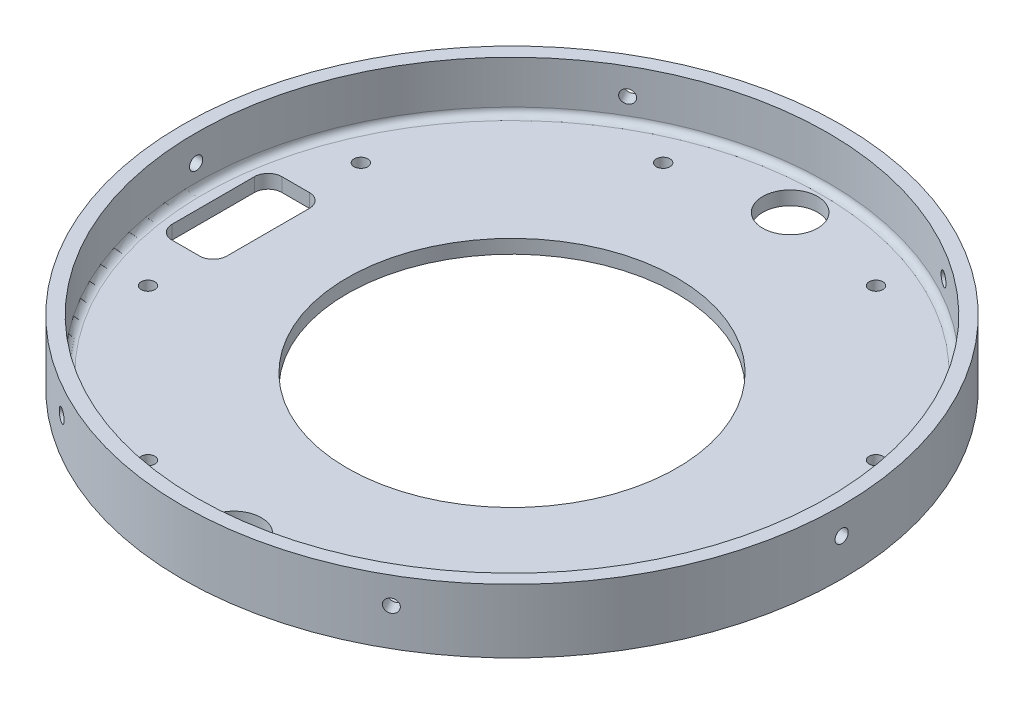
from build123d import *

# Parameters (mm, degrees)
SKETCH1_R           = 76.2
BOSS_EXTRUDE1_DEPTH = 16.256
SHELL1_T            = -3.175
FILLET1_R           = 1.5875
SKETCH2_R           = 38.1
CUT_EXTRUDE1_DEPTH  = 16.256
SKETCH3_R           = 1.524
CUT_EXTRUDE2_DEPTH  = 76.2
CIRPATTERN1_COUNT   = 6
CUT_EXTRUDE4_START  = -1.524
SKETCH5_R           = 76.2
CUT_EXTRUDE4_DEPTH  = 1.524
SKETCH6_R           = 6.35
CUT_EXTRUDE5_DEPTH  = 12.7
SKETCH7_R           = 1.5875
CUT_EXTRUDE6_DEPTH  = 6.35
SKETCH8_W           = 12.7
SKETCH8_H           = 25.4
CUT_EXTRUDE7_DEPTH  = 6.35
FILLET2_R           = 3.175


with BuildPart() as part:
    # Sketch1 → Boss-Extrude1 (new body)
    with BuildSketch(Plane(origin=(0, 0, 0), x_dir=(1, 0, 0), z_dir=(0, 1, 0))):
        Circle(SKETCH1_R)
    extrude(amount=BOSS_EXTRUDE1_DEPTH)

    # Shell1
    shell1_openings = [part.faces().sort_by_distance(p)[0] for p in [
        (0, 16.256, 0),
    ]]
    offset(amount=SHELL1_T, openings=shell1_openings, kind=Kind.INTERSECTION)

    # Fillet1
    fillet1_edges = [part.edges().sort_by_distance(p)[0] for p in [
        (-73.025, 3.175, 0),
    ]]
    fillet(fillet1_edges, radius=FILLET1_R)

    # Sketch2 → Cut-Extrude1 (cut)
    with BuildSketch(Plane.XZ):
        Circle(SKETCH2_R)
    extrude(amount=-CUT_EXTRUDE1_DEPTH, mode=Mode.SUBTRACT)

    # Sketch3 → Cut-Extrude2 (cut)
    with BuildSketch(Plane(origin=(0, 0, 0), x_dir=(0, 0, -1), z_dir=(1, 0, 0))):
        with Locations((0, 8.636)):
            Circle(SKETCH3_R)
    cut_extrude2 = extrude(amount=-CUT_EXTRUDE2_DEPTH, mode=Mode.SUBTRACT)

    # CirPattern1: Cut-Extrude2 ×6 about axis
    cirpattern1_axis = Axis((0, 16.256, 0), (0, -1, 0))
    for i in range(1, CIRPATTERN1_COUNT):
        add(cut_extrude2.rotate(cirpattern1_axis, i * 360 / CIRPATTERN1_COUNT), mode=Mode.SUBTRACT)

    # Sketch5 → Cut-Extrude4 (cut)
    with BuildSketch(Plane(origin=(0, 16.256, 0), x_dir=(1, 0, 0), z_dir=(0, 1, 0)).offset(CUT_EXTRUDE4_START)):
        Circle(SKETCH5_R)
    extrude(amount=CUT_EXTRUDE4_DEPTH, mode=Mode.SUBTRACT)

    # Sketch6 → Cut-Extrude5 (cut)
    with BuildSketch(Plane(origin=(0, 3.175, 0), x_dir=(1, 0, 0), z_dir=(0, 1, 0))):
        with Locations((0, 64.2874)):
            Circle(SKETCH6_R)
        with Locations((0, -64.2874)):
            Circle(SKETCH6_R)
    extrude(amount=-CUT_EXTRUDE5_DEPTH, mode=Mode.SUBTRACT)

    # Sketch7 → Cut-Extrude6 (cut)
    with BuildSketch(Plane(origin=(0, 3.175, 0), x_dir=(1, 0, 0), z_dir=(0, 1, 0))):
        with Locations((-24.6, 59.525)):
            Circle(SKETCH7_R)
        with Locations((24.6, 59.525)):
            Circle(SKETCH7_R)
        with Locations((24.6, -59.525)):
            Circle(SKETCH7_R)
        with Locations((-24.6, -59.525)):
            Circle(SKETCH7_R)
        with Locations((-59.525, -24.6)):
            Circle(SKETCH7_R)
        with Locations((-59.525, 24.6)):
            Circle(SKETCH7_R)
        with Locations((59.525, 24.6)):
            Circle(SKETCH7_R)
        with Locations((59.525, -24.6)):
            Circle(SKETCH7_R)
    extrude(amount=-CUT_EXTRUDE6_DEPTH, mode=Mode.SUBTRACT)

    # Sketch8 → Cut-Extrude7 (cut)
    with BuildSketch(Plane(origin=(0, 3.175, 0), x_dir=(1, 0, 0), z_dir=(0, 1, 0))):
        with Locations((-62.7, 0)):
            Rectangle(SKETCH8_W, SKETCH8_H)
    extrude(amount=-CUT_EXTRUDE7_DEPTH, mode=Mode.SUBTRACT)

    # Fillet2
    fillet2_edges = [part.edges().sort_by_distance(p)[0] for p in [
        (-69.05, 1.5875, 12.7),
        (-56.35, 1.5875, 12.7),
        (-56.35, 1.5875, -12.7),
        (-69.05, 1.5875, -12.7),
    ]]
    fillet(fillet2_edges, radius=FILLET2_R)


solid = part.part
